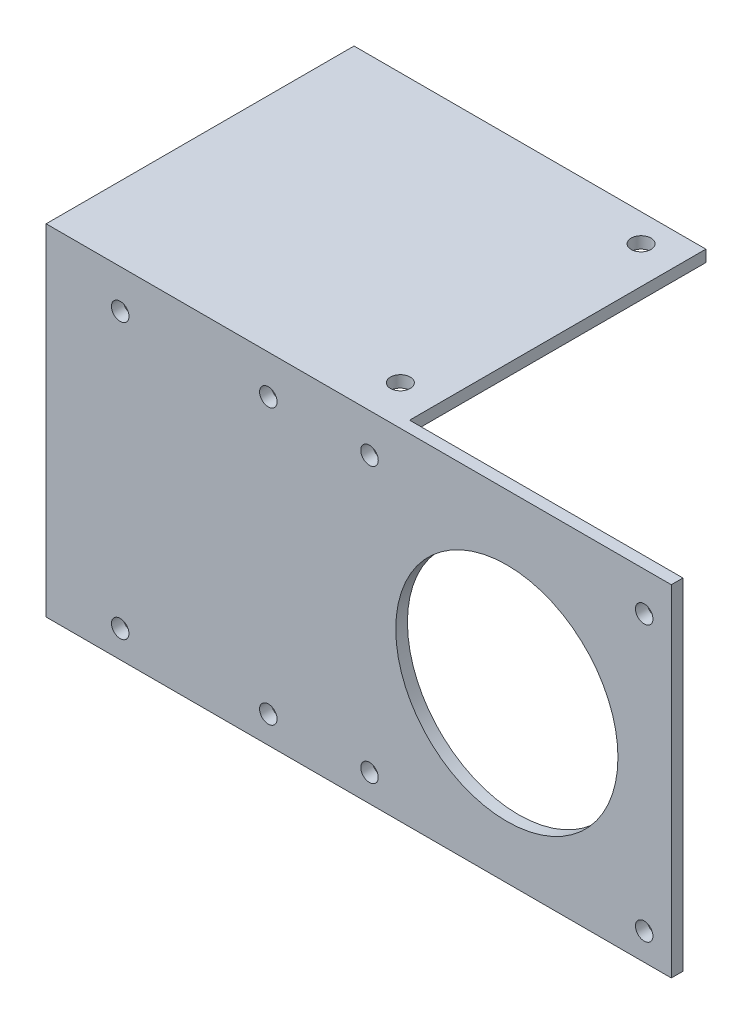
from build123d import *

# Parameters (mm, degrees)
SKETCH1_W           = 107.2
SKETCH1_H           = 58.4
SKETCH1_R           = 1.5
SKETCH1_R_2         = 19.05
BOSS_EXTRUDE1_DEPTH = 2
SKETCH2_W           = 60.325
SKETCH2_H           = 2
BOSS_EXTRUDE2_DEPTH = 50.8
SKETCH3_R           = 1.7
CUT_EXTRUDE1_DEPTH  = 134.004661572


with BuildPart() as part:
    # Sketch1 → Boss-Extrude1 (new body)
    with BuildSketch(Plane.XY):
        with Locations((53.6, 29.2)):
            Rectangle(SKETCH1_W, SKETCH1_H)
        with Locations((102.55, 51.75)):
            Circle(SKETCH1_R, mode=Mode.SUBTRACT)
        with Locations((102.55, 4.65)):
            Circle(SKETCH1_R, mode=Mode.SUBTRACT)
        with Locations((55.45, 4.65)):
            Circle(SKETCH1_R, mode=Mode.SUBTRACT)
        with Locations((55.45, 51.75)):
            Circle(SKETCH1_R, mode=Mode.SUBTRACT)
        with Locations((12.7, 51.75)):
            Circle(SKETCH1_R, mode=Mode.SUBTRACT)
        with Locations((38.1, 51.75)):
            Circle(SKETCH1_R, mode=Mode.SUBTRACT)
        with Locations((12.7, 4.65)):
            Circle(SKETCH1_R, mode=Mode.SUBTRACT)
        with Locations((38.1, 4.65)):
            Circle(SKETCH1_R, mode=Mode.SUBTRACT)
        with Locations((79, 28.2)):
            Circle(SKETCH1_R_2, mode=Mode.SUBTRACT)
    extrude(amount=-BOSS_EXTRUDE1_DEPTH)

    # Sketch2 → Boss-Extrude2 (add)
    with BuildSketch(Plane(origin=(0, 0, -2), x_dir=(-1, 0, 0), z_dir=(0, 0, -1))):
        with Locations((-30.1625, 57.4)):
            Rectangle(SKETCH2_W, SKETCH2_H)
    extrude(amount=BOSS_EXTRUDE2_DEPTH)

    # Sketch3 → Cut-Extrude1 (cut, through all)
    with BuildSketch(Plane(origin=(0, 58.4, 0), x_dir=(1, 0, 0), z_dir=(0, 1, 0))):
        with Locations((53.975, 48.0375)):
            Circle(SKETCH3_R)
        with Locations((53.975, 6.7625)):
            Circle(SKETCH3_R)
    extrude(amount=-CUT_EXTRUDE1_DEPTH, mode=Mode.SUBTRACT)


solid = part.part
